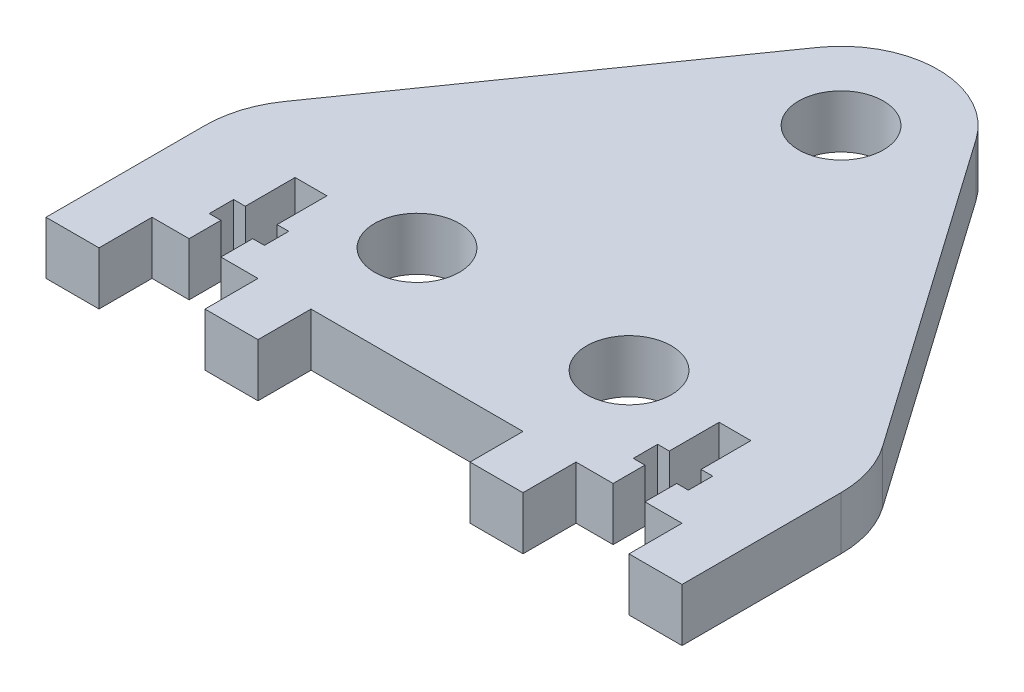
from build123d import *

# Parameters (mm, degrees)
SKETCH1_R           = 4
BOSS_EXTRUDE1_DEPTH = 5


with BuildPart() as part:
    # Sketch1 → Boss-Extrude1 (new body)
    with BuildSketch(Plane(origin=(0, 0, 0), x_dir=(1, 0, 0), z_dir=(0, 1, 0))):
        with BuildLine():
            Line((-30, 10), (-30, -5))
            Line((-30, -5), (-25, -5))
            Line((-25, -5), (-25, 0))
            Line((-25, 0), (-21.5, 0))
            Line((-21.5, 0), (-21.5, 3))
            Line((-21.5, 3), (-22.6, 3))
            Line((-22.6, 3), (-22.6, 5.3))
            Line((-22.6, 5.3), (-21.5, 5.3))
            Line((-21.5, 5.3), (-21.5, 10))
            Line((-21.5, 10), (-18.5, 10))
            Line((-18.5, 10), (-18.5, 5.3))
            Line((-18.5, 5.3), (-17.4, 5.3))
            Line((-17.4, 5.3), (-17.4, 3))
            Line((-17.4, 3), (-18.5, 3))
            Line((-18.5, 3), (-18.5, 0))
            Line((-18.5, 0), (-15, 0))
            Line((-15, 0), (-15, -5))
            Line((-15, -5), (-10, -5))
            Line((-10, -5), (-10, 0))
            Line((-10, 0), (10, 0))
            Line((10, 0), (10, -5))
            Line((10, -5), (15, -5))
            Line((15, -5), (15, 0))
            Line((15, 0), (18.5, 0))
            Line((18.5, 0), (18.5, 3))
            Line((18.5, 3), (17.4, 3))
            Line((17.4, 3), (17.4, 5.3))
            Line((17.4, 5.3), (18.5, 5.3))
            Line((18.5, 5.3), (18.5, 10))
            Line((18.5, 10), (21.5, 10))
            Line((21.5, 10), (21.5, 5.3))
            Line((21.5, 5.3), (22.6, 5.3))
            Line((22.6, 5.3), (22.6, 3))
            Line((22.6, 3), (21.5, 3))
            Line((21.5, 3), (21.5, 0))
            Line((21.5, 0), (25, 0))
            Line((25, 0), (25, -5))
            Line((25, -5), (30, -5))
            Line((30, -5), (30, 10))
            ThreePointArc((30, 10), (29.536078258, 13.01051681), (28.187357708, 15.741704779))
            Line((28.187357708, 15.741704779), (7.491105691, 45.253430824))
            ThreePointArc((7.491105691, 45.253430824), (0, 49.149601078), (-7.491105691, 45.253430824))
            Line((-7.491105691, 45.253430824), (-28.187357708, 15.741704779))
            ThreePointArc((-28.187357708, 15.741704779), (-29.536078258, 13.01051681), (-30, 10))
        make_face()
        with Locations((0, 40)):
            Circle(SKETCH1_R, mode=Mode.SUBTRACT)
        with Locations((-10, 10)):
            Circle(SKETCH1_R, mode=Mode.SUBTRACT)
        with Locations((10, 10)):
            Circle(SKETCH1_R, mode=Mode.SUBTRACT)
    extrude(amount=BOSS_EXTRUDE1_DEPTH)


solid = part.part
